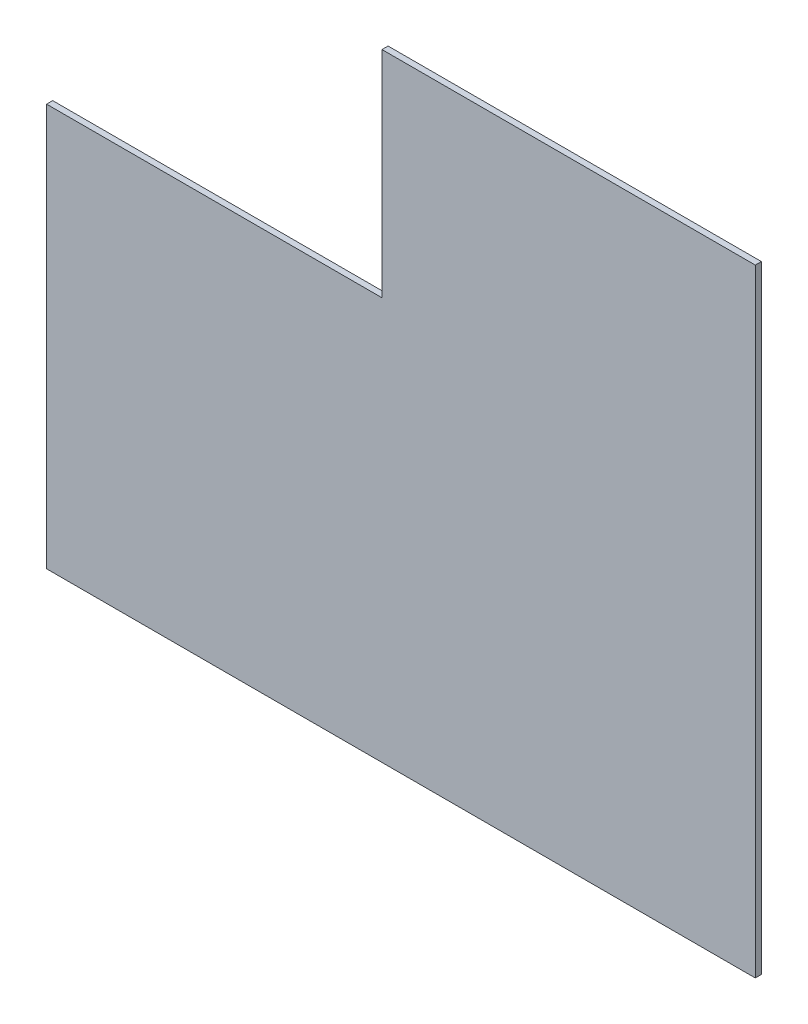
from build123d import *

# Parameters (mm, degrees)
EXTRUDE_1_DEPTH = 10


with BuildPart() as part:
    # Эскиз2 → Бобышка-Вытянуть1 (new body)
    with BuildSketch(Plane.XY):
        Polygon((1162.3, -506.285), (0, -506.285), (0, 153.715), (550, 153.715), (550, 506.285), (1162.3, 506.285), align=None)
    extrude(amount=-EXTRUDE_1_DEPTH)


solid = part.part
